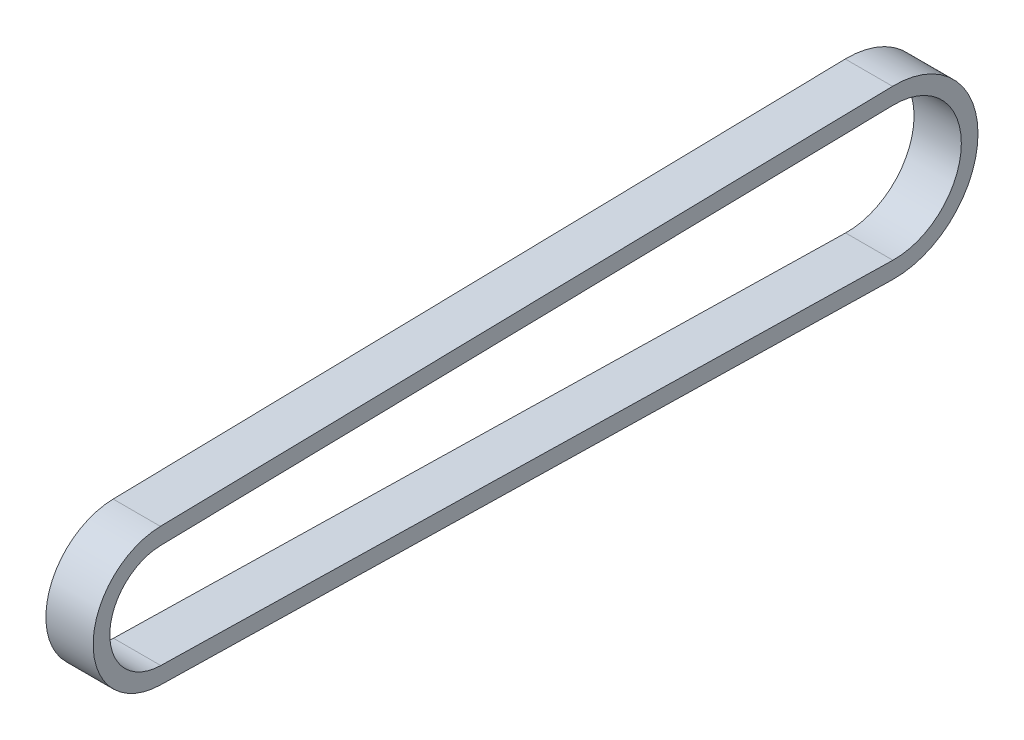
from build123d import *

# Parameters (mm, degrees)
BOSS_EXTRUDE1_DEPTH = 4.5


with BuildPart() as part:
    # Sketch1 → Boss-Extrude1 (new, symmetric)
    with BuildSketch(Plane(origin=(0, 0, 0), x_dir=(0, 0, -1), z_dir=(1, 0, 0))):
        with BuildLine():
            Line((-0.268771319, 13.080779064), (139.143771363, 15.945294455))
            ThreePointArc((139.143771363, 15.945294455), (155.42006, 0), (139.143771363, -15.945294455))
            Line((139.143771363, -15.945294455), (-0.268771319, -13.080779064))
            ThreePointArc((-0.268771319, -13.080779064), (-13.08354, 0), (-0.268771319, 13.080779064))
        make_face()
        with BuildLine():
            Line((-0.203548227, 9.906449064), (139.208994455, 12.770964456))
            ThreePointArc((139.208994455, 12.770964456), (152.24506, 0), (139.208994455, -12.770964456))
            Line((139.208994455, -12.770964456), (-0.203548227, -9.906449064))
            ThreePointArc((-0.203548227, -9.906449064), (-9.90854, 0), (-0.203548227, 9.906449064))
        make_face(mode=Mode.SUBTRACT)
    extrude(amount=BOSS_EXTRUDE1_DEPTH, both=True)


solid = part.part
